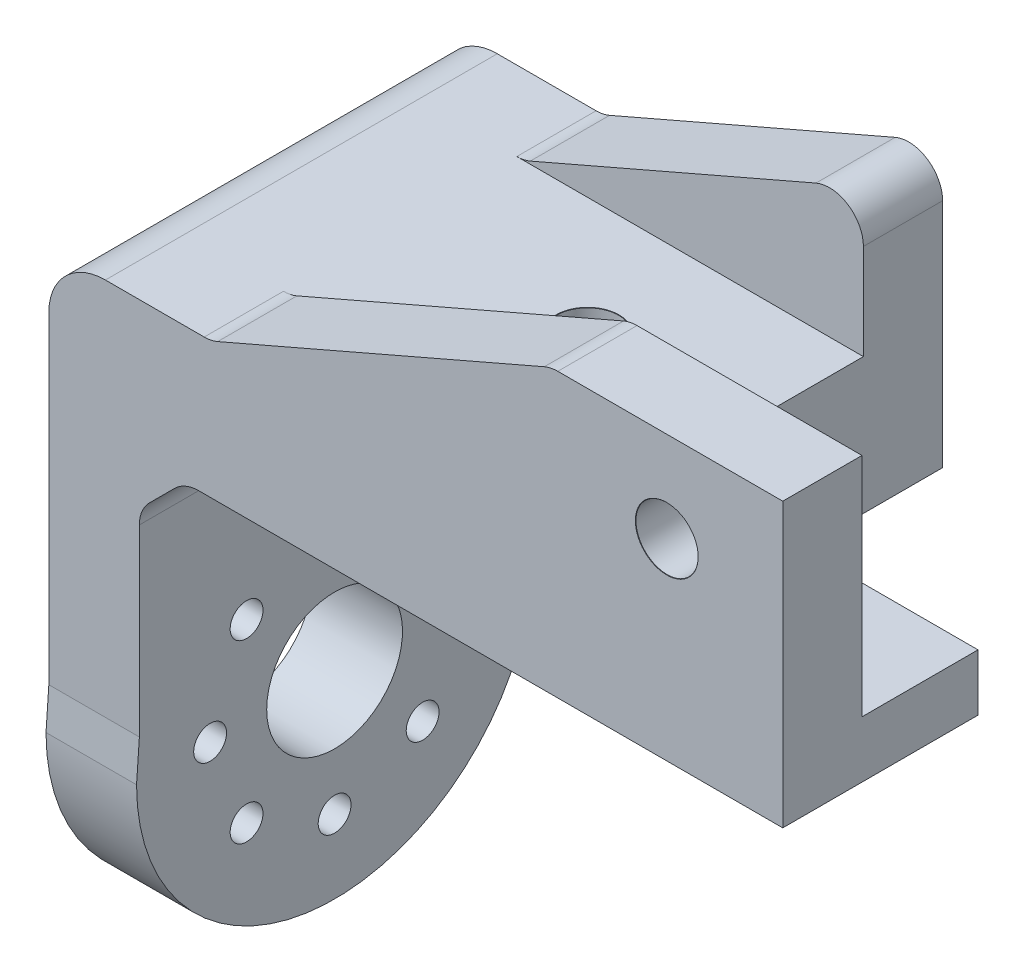
from build123d import *

# Parameters (mm, degrees)
EXTRUDE_1_DEPTH                = 35
SKETCH_6_R                     = 6
CUT_EXTRUDE_2_DEPTH            = 101.2
SKETCH_7_R                     = 5.75
EXTRUDE_3_DEPTH                = 101.2
CUT_EXTRUDE_3_REACH            = 87.885
SKETCH_16_W                    = 20.2
SKETCH_16_H                    = 20.2
CUT_EXTRUDE_5_DEPTH            = 30
SKETCH_15_W                    = 20.5
SKETCH_15_H                    = 35
CUT_EXTRUDE_6_DEPTH            = 4.25
SKETCH_17_W                    = 20.5
SKETCH_17_H                    = 35
CUT_EXTRUDE_7_DEPTH            = 4.25
CUT_EXTRUDE_8_REACH            = 124.708
CUT_EXTRUDE_9_DEPTH            = 36.25
CUT_EXTRUDE_10_DEPTH           = 36.25
CUT_EXTRUDE_12_DEPTH           = 86.884879429
CUT_EXTRUDE1_START             = -50.6
SKETCH1_W                      = 50
SKETCH1_H                      = 80
CUT_EXTRUDE1_DEPTH             = 50.6
M5_CLEARANCE_HOLE2_D           = 5.5
M5_CLEARANCE_HOLE2_CSINK_D     = 5.55
M5_CLEARANCE_HOLE2_CSINK_ANGLE = 90
CUT_EXTRUDE_START              = -50.6
SKETCH_26_W                    = 72.367521013
SKETCH_26_H                    = 30.268087809
CUT_EXTRUDE_13_DEPTH           = 50.6
SKETCH_27_W                    = 40.35
SKETCH_27_H                    = 30.75
EXTRUDE_4_DEPTH                = 7
EXTRUDE_START                  = 4
EXTRUDE_5_DEPTH                = 4
EXTRUDE_8_DEPTH                = 8
HOLE_WIZARD_M2_5_1_D           = 2.9
HOLE_WIZARD_M2_5_1_CSINK_D     = 2.95
HOLE_WIZARD_M2_5_1_CSINK_ANGLE = 90
FILLET_START                   = 1
FILLET_1_DEPTH                 = 33
SKETCH_31_W                    = 13.25
SKETCH_31_H                    = 5
EXTRUDE_6_DEPTH                = 10.25
SKETCH_32_W                    = 13.25
SKETCH_32_H                    = 5
CUT_EXTRUDE_14_DEPTH           = 10.25
SKETCH_33_W                    = 50.5
SKETCH_33_H                    = 3
EXTRUDE_7_DEPTH                = 20
CUT_EXTRUDE_15_DEPTH           = 3
HOLE_WIZARD_M5_2_D             = 5.5
HOLE_WIZARD_M5_2_CSINK_D       = 5.55
HOLE_WIZARD_M5_2_CSINK_ANGLE   = 90
EXTRUDE_10_DEPTH               = 4
HOLE_WIZARD_M5_1_D             = 5.5
HOLE_WIZARD_M5_1_CSINK_D       = 5.55
HOLE_WIZARD_M5_1_CSINK_ANGLE   = 90
SKETCH_39_W                    = 10
SKETCH_39_H                    = 10
CUT_EXTRUDE_17_DEPTH           = 4
CHAMFER_1_SIZE                 = 4
EXTRUDE_START_2                = 2
EXTRUDE_15_DEPTH               = 2
EXTRUDE_START_3                = 27.625
EXTRUDE_16_DEPTH               = 7
FILLET_8_R                     = 3


with BuildPart() as part:
    # 草图1 → 凸台-拉伸1 (new body)
    with BuildSketch(Plane.XY):
        Polygon((50.6, -0.076277531), (50.6, 29.923722469), (20, 59.923722469), (-20, 59.923722469), (-50.6, 29.923722469), (-50.6, -0.076277531), align=None)
    extrude(amount=EXTRUDE_1_DEPTH)

    # 草图6 → 切除-拉伸2 (cut)
    with BuildSketch(Plane.ZY.offset(50.6)):
        with Locations((17.5, -0.076277531)):
            Circle(SKETCH_6_R)
    extrude(amount=-CUT_EXTRUDE_2_DEPTH, mode=Mode.SUBTRACT)

    # 草图7 → 凸台-拉伸3 (add)
    with BuildSketch(Plane.ZY.offset(50.6)):
        with Locations((5.75, -0.076277531)):
            Circle(SKETCH_7_R)
        with Locations((29.25, -0.076277531)):
            Circle(SKETCH_7_R)
    extrude(amount=-EXTRUDE_3_DEPTH)

    # 切除-拉伸3: up to this face of the body (flat: up to its plane)
    cut_extrude_3_end = Plane(part.part.faces().sort_by_distance((0, 26.361440746, 0))[0])
    # 草图8 → 切除-拉伸3 (cut, up to the picked face)
    with BuildSketch(Plane.XY.offset(35), mode=Mode.PRIVATE) as cut_extrude_3_sk1:
        Polygon((-46.6, -0.076277531), (-46.6, 24.923722469), (46.6, 24.923722469), (46.6, -0.076277531), (46.6, -12.111349377), (-46.6, -12.111349377), align=None)
    cut_extrude_3_tool1 = split(extrude(cut_extrude_3_sk1.sketch, amount=-CUT_EXTRUDE_3_REACH, mode=Mode.PRIVATE), bisect_by=cut_extrude_3_end, keep=Keep.BOTH, mode=Mode.PRIVATE)
    add(cut_extrude_3_tool1.solids().sort_by(Axis((0, 6.406187, 35), (0, 0, -1)))[0], mode=Mode.SUBTRACT)

    # 草图16 → 切除-拉伸5 (cut)
    with BuildSketch(Plane(origin=(0, 59.923722469, 0), x_dir=(1, 0, 0), z_dir=(0, 1, 0))):
        with Locations((0, -17.5)):
            Rectangle(SKETCH_16_W, SKETCH_16_H)
    extrude(amount=-CUT_EXTRUDE_5_DEPTH, mode=Mode.SUBTRACT)

    # 草图15 → 切除-拉伸6 (cut)
    with BuildSketch(Plane.XY.offset(35)):
        with Locations((0, 42.423722469)):
            Rectangle(SKETCH_15_W, SKETCH_15_H)
    extrude(amount=-CUT_EXTRUDE_6_DEPTH, mode=Mode.SUBTRACT)

    # 草图17 → 切除-拉伸7 (cut)
    with BuildSketch(Plane(origin=(0, 0, 0), x_dir=(-1, 0, 0), z_dir=(0, 0, -1))):
        with Locations((0, 42.423722469)):
            Rectangle(SKETCH_17_W, SKETCH_17_H)
    extrude(amount=-CUT_EXTRUDE_7_DEPTH, mode=Mode.SUBTRACT)

    # 切除-拉伸8: up to this face of the body (flat: up to its plane)
    cut_extrude_8_end = Plane(part.part.faces().sort_by_distance((-50.6, 13.914643518, 17.5))[0])
    # 草图20 → 切除-拉伸8 (cut, up to the picked face)
    with BuildSketch(Plane(origin=(50.6, 0, 0), x_dir=(0, 0, -1), z_dir=(1, 0, 0)), mode=Mode.PRIVATE) as cut_extrude_8_sk1:
        Polygon((-30.75, 59.923722469), (-35, 59.923722469), (-35, -0.076277531), align=None)
    cut_extrude_8_tool1 = split(extrude(cut_extrude_8_sk1.sketch, amount=-CUT_EXTRUDE_8_REACH, mode=Mode.PRIVATE), bisect_by=cut_extrude_8_end, keep=Keep.BOTH, mode=Mode.PRIVATE)
    # 草图20 → 切除-拉伸8 (cut, up to the picked face)
    with BuildSketch(Plane(origin=(50.6, 0, 0), x_dir=(0, 0, -1), z_dir=(1, 0, 0)), mode=Mode.PRIVATE) as cut_extrude_8_sk2:
        Polygon((0, -0.076277531), (0, 59.923722469), (-4.25, 59.923722469), align=None)
    cut_extrude_8_tool2 = split(extrude(cut_extrude_8_sk2.sketch, amount=-CUT_EXTRUDE_8_REACH, mode=Mode.PRIVATE), bisect_by=cut_extrude_8_end, keep=Keep.BOTH, mode=Mode.PRIVATE)
    add(cut_extrude_8_tool1.solids().sort_by(Axis((50.6, 39.923722, 33.583333), (-1, 0, 0)))[0], mode=Mode.SUBTRACT)
    add(cut_extrude_8_tool2.solids().sort_by(Axis((50.6, 39.923722, 1.416667), (-1, 0, 0)))[0], mode=Mode.SUBTRACT)

    # 草图21 → 切除-拉伸9 (cut)
    with BuildSketch(Plane(origin=(50.6, 0, 0), x_dir=(0, 0, -1), z_dir=(1, 0, 0))):
        Polygon((-27.6, 59.923722469), (-29.725, 29.923722469), (-5.275, 29.923722469), (-7.4, 59.923722469), align=None)
    extrude(amount=-CUT_EXTRUDE_9_DEPTH, mode=Mode.SUBTRACT)

    # 草图22 → 切除-拉伸10 (cut)
    with BuildSketch(Plane.ZY.offset(50.6)):
        Polygon((29.725, 29.923722469), (27.6, 59.923722469), (7.4, 59.923722469), (5.275, 29.923722469), align=None)
    extrude(amount=-CUT_EXTRUDE_10_DEPTH, mode=Mode.SUBTRACT)

    # 草图25 → 切除-拉伸12 (cut, through all)
    with BuildSketch(Plane.XY):
        Polygon((38.35, 33.923722469), (18.35, 33.923722469), (18.35, 53.531565607), align=None)
        Polygon((-18.35, 53.531565607), (-38.35, 33.923722469), (-18.35, 33.923722469), align=None)
    extrude(amount=CUT_EXTRUDE_12_DEPTH, mode=Mode.SUBTRACT)

    # Sketch1 → Cut-Extrude1 (cut)
    with BuildSketch(Plane(origin=(50.6, 0, 0), x_dir=(0, 0, -1), z_dir=(1, 0, 0)).offset(CUT_EXTRUDE1_START)):
        with Locations((-17.5, 29.923722469)):
            Rectangle(SKETCH1_W, SKETCH1_H)
    extrude(amount=CUT_EXTRUDE1_DEPTH, mode=Mode.SUBTRACT)

    # M5 Clearance Hole2 (through all)
    with Locations(Plane.ZY.offset(14.35)):
        with Locations((17.5, 36.923722469), (17.5, 51.923722469)):
            CounterSinkHole(M5_CLEARANCE_HOLE2_D / 2, M5_CLEARANCE_HOLE2_CSINK_D / 2, counter_sink_angle=M5_CLEARANCE_HOLE2_CSINK_ANGLE)

    # 草图26 → 切除-拉伸13 (cut)
    with BuildSketch(Plane(origin=(0, 0, 0), x_dir=(0, 0, -1), z_dir=(1, 0, 0)).offset(CUT_EXTRUDE_START)):
        with Locations((-20.049143716, 45.057766374)):
            Rectangle(SKETCH_26_W, SKETCH_26_H)
    extrude(amount=CUT_EXTRUDE_13_DEPTH, mode=Mode.SUBTRACT)

    # 草图27 → 凸台-拉伸4 (add)
    with BuildSketch(Plane(origin=(0, 29.923722469, 0), x_dir=(1, 0, 0), z_dir=(0, 1, 0))):
        with Locations((-30.425, -17.5)):
            Rectangle(SKETCH_27_W, SKETCH_27_H)
    extrude(amount=EXTRUDE_4_DEPTH)

    # 草图28 → 凸台-拉伸5 (add)
    with BuildSketch(Plane.ZY.offset(50.6).offset(EXTRUDE_START)):
        with BuildLine():
            Line((35, -0.076277531), (32.875, 29.923722469))
            Line((32.875, 29.923722469), (32.875, 36.923722469))
            Line((32.875, 36.923722469), (2.125, 36.923722469))
            Line((2.125, 36.923722469), (2.125, 29.923722469))
            Line((2.125, 29.923722469), (0, -0.076277531))
            ThreePointArc((0, -0.076277531), (5.75, -5.826277531), (11.5, -0.076277531))
            ThreePointArc((11.5, -0.076277531), (17.5, 5.923722469), (23.5, -0.076277531))
            ThreePointArc((23.5, -0.076277531), (29.25, -5.826277531), (35, -0.076277531))
        make_face()
    extrude(amount=-EXTRUDE_5_DEPTH)

    # 草图36 → 凸台-拉伸8 (add)
    with BuildSketch(Plane.ZY.offset(54.6)):
        with BuildLine():
            ThreePointArc((11.5, -0.076277531), (17.5, -6.076277531), (23.5, -0.076277531))
            ThreePointArc((23.5, -0.076277531), (29.25, -5.826277531), (35, -0.076277531))
            ThreePointArc((35, -0.076277531), (17.5, -17.576277531), (0, -0.076277531))
            ThreePointArc((0, -0.076277531), (5.75, -5.826277531), (11.5, -0.076277531))
        make_face()
    extrude(amount=-EXTRUDE_8_DEPTH)

    # M2.5 间隙孔1 (through all)
    with Locations(Plane(origin=(-54.6, 0, 0), x_dir=(0, 0, -1), z_dir=(-1, 0, 0))):
        with Locations((-25.278174593, -7.701897062), (-17.5, -10.923722469), (-9.721825407, -7.701897062), (-6.5, 0.076277531), (-9.721825407, 7.854452124), (-17.5, 11.076277531), (-25.278174593, 7.854452124), (-28.5, 0.076277531)):
            CounterSinkHole(HOLE_WIZARD_M2_5_1_D / 2, HOLE_WIZARD_M2_5_1_CSINK_D / 2, counter_sink_angle=HOLE_WIZARD_M2_5_1_CSINK_ANGLE)

    # 圆角1: read off the stored shape, not the designer's step
    # 圆角1 outline → 圆角1 (cut)
    with BuildSketch(Plane.XY.offset(FILLET_START)):
        with BuildLine():
            Line((-54.6, 36.923722469), (-54.6, 31.923722469))
            ThreePointArc((-54.6, 31.923722469), (-53.135533906, 35.459256375), (-49.6, 36.923722469))
            Line((-49.6, 36.923722469), (-54.6, 36.923722469))
        make_face()
    extrude(amount=FILLET_1_DEPTH, mode=Mode.SUBTRACT)

    # 草图31 → 凸台-拉伸6 (add)
    with BuildSketch(Plane(origin=(0, 0, 0), x_dir=(0, 0, -1), z_dir=(1, 0, 0))):
        with Locations((-24.125, 27.423722469)):
            Rectangle(SKETCH_31_W, SKETCH_31_H)
    extrude(amount=EXTRUDE_6_DEPTH)

    # 草图32 → 切除-拉伸14 (cut)
    with BuildSketch(Plane(origin=(0, 0, 0), x_dir=(0, 0, -1), z_dir=(1, 0, 0))):
        with Locations((-10.875, 27.423722469)):
            Rectangle(SKETCH_32_W, SKETCH_32_H)
    extrude(amount=-CUT_EXTRUDE_14_DEPTH, mode=Mode.SUBTRACT)

    # 草图33 → 凸台-拉伸7 (add)
    with BuildSketch(Plane(origin=(0, 29.923722469, 0), x_dir=(1, 0, 0), z_dir=(0, 1, 0))):
        with Locations((-15, -29.25)):
            Rectangle(SKETCH_33_W, SKETCH_33_H)
    extrude(amount=EXTRUDE_7_DEPTH)

    # 草图34 → 切除-拉伸15 (cut)
    with BuildSketch(Plane.XY.offset(30.75)):
        Polygon((-40.25, 36.923722469), (-10.25, 49.923722469), (-40.25, 49.923722469), align=None)
    extrude(amount=-CUT_EXTRUDE_15_DEPTH, mode=Mode.SUBTRACT)

    # M5 间隙孔2 (through all)
    with Locations(Plane(origin=(0, 36.923722469, 0), x_dir=(1, 0, 0), z_dir=(0, 1, 0))):
        with Locations((-24.25, -17.5)):
            CounterSinkHole(HOLE_WIZARD_M5_2_D / 2, HOLE_WIZARD_M5_2_CSINK_D / 2, counter_sink_angle=HOLE_WIZARD_M5_2_CSINK_ANGLE)

    # 草图43 → 凸台-拉伸10 (add)
    with BuildSketch(Plane.XY.offset(30.75)):
        with BuildLine():
            Line((-49.6, 36.923722469), (-40.25, 36.923722469))
            Line((-40.25, 36.923722469), (-10.25, 49.923722469))
            Line((-10.25, 49.923722469), (10.25, 49.923722469))
            Line((10.25, 49.923722469), (10.25, 24.923722469))
            Line((10.25, 24.923722469), (-10.25, 24.923722469))
            Line((-10.25, 24.923722469), (-46.6, 24.923722469))
            Line((-46.6, 24.923722469), (-46.6, -0.076277531))
            Line((-46.6, -0.076277531), (-54.6, -0.076277531))
            Line((-54.6, -0.076277531), (-54.6, 29.923722469))
            Line((-54.6, 29.923722469), (-54.6, 31.923722469))
            ThreePointArc((-54.6, 31.923722469), (-53.135533906, 35.459256375), (-49.6, 36.923722469))
        make_face()
    extrude(amount=EXTRUDE_10_DEPTH)

    # M5 间隙孔1 (through all)
    with Locations(Plane.XY.offset(34.75)):
        with Locations((0, 41.923722469)):
            CounterSinkHole(HOLE_WIZARD_M5_1_D / 2, HOLE_WIZARD_M5_1_CSINK_D / 2, counter_sink_angle=HOLE_WIZARD_M5_1_CSINK_ANGLE)

    # 草图39 → 切除-拉伸17 (cut)
    with BuildSketch(Plane.XZ.offset(-24.923722469)):
        with Locations((-24.25, 17.5)):
            Rectangle(SKETCH_39_W, SKETCH_39_H)
    extrude(amount=-CUT_EXTRUDE_17_DEPTH, mode=Mode.SUBTRACT)

    # 倒角1
    chamfer_1_edges = [part.edges().sort_by_distance(p)[0] for p in [
        (-46.6, 24.923722469, 18.260416667),
    ]]
    chamfer(chamfer_1_edges, length=CHAMFER_1_SIZE)

    # 草图46 → 凸台-拉伸15 (add)
    with BuildSketch(Plane(origin=(0, -0.075356889, 2.125), x_dir=(-1, 0, 0), z_dir=(0, 0, -1)).offset(EXTRUDE_START_2)):
        with BuildLine():
            Line((54.6, 29.999079359), (54.6, 31.999079359))
            ThreePointArc((54.6, 31.999079359), (53.135533906, 35.534613265), (49.6, 36.999079359))
            Line((49.6, 36.999079359), (10.25, 36.999079359))
            Line((10.25, 36.999079359), (10.25, 29.999079359))
            Line((10.25, 29.999079359), (10.25, 24.999079359))
            Line((10.25, 24.999079359), (42.6, 24.999079359))
            Line((42.6, 24.999079359), (46.6, 20.999079359))
            Line((46.6, 20.999079359), (46.6, -0.000920641))
            Line((46.6, -0.000920641), (54.6, -0.000920641))
            Line((54.6, -0.000920641), (54.6, 29.999079359))
        make_face()
    extrude(amount=-EXTRUDE_15_DEPTH)

    # 草图45 → 凸台-拉伸16 (add)
    with BuildSketch(Plane(origin=(0, 0, 27.75), x_dir=(-1, 0, 0), z_dir=(0, 0, -1)).offset(EXTRUDE_START_3)):
        Polygon((10.25, 49.923722469), (10.25, 36.923722469), (40.25, 36.923722469), align=None)
    extrude(amount=-EXTRUDE_16_DEPTH)

    # 圆角8
    fillet_8_edges = [part.edges().sort_by_distance(p)[0] for p in [
        (-40.25, 36.923722469, 31.25),
        (-10.25, 49.923722469, 31.25),
        (-46.6, 20.923722469, 17.4375),
        (-42.6, 24.923722469, 17.4375),
        (-10.25, 49.923722469, 3.625),
        (-40.25, 36.923722469, 3.625),
    ]]
    fillet(fillet_8_edges, radius=FILLET_8_R)


solid = part.part
